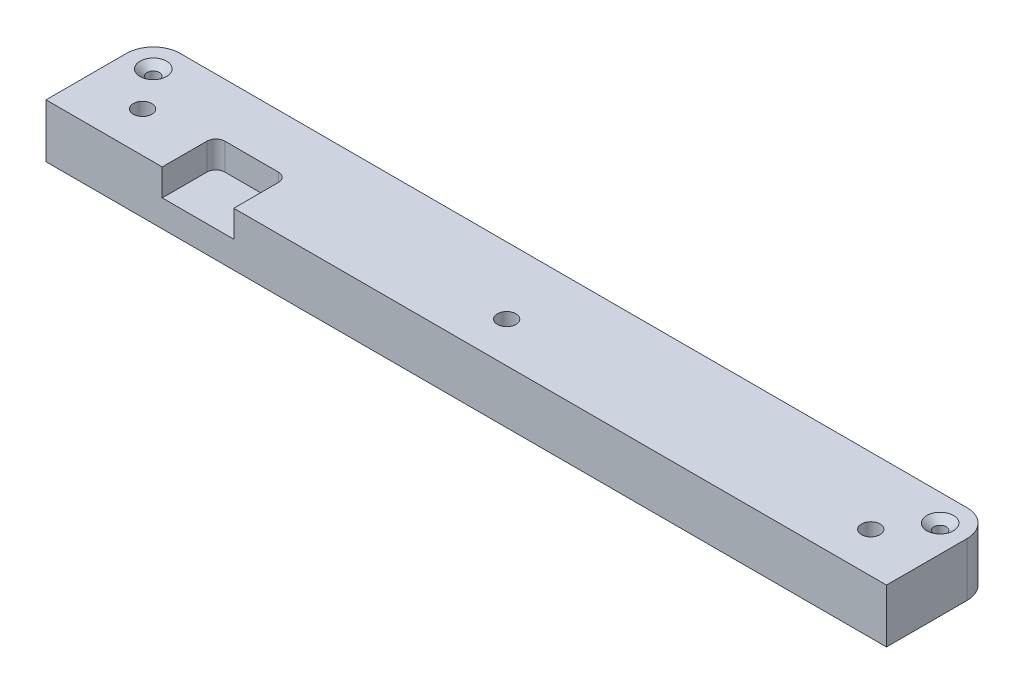
from build123d import *

# Parameters (mm, degrees)
SKETCH1_W           = 298.45
SKETCH1_H           = 38.1
BOSS_EXTRUDE1_DEPTH = 19.05
FILLET1_R           = 9.525
SKETCH2_R           = 3.302
CUT_EXTRUDE1_DEPTH  = 14.2875
SKETCH4_R           = 1.6256
CUT_EXTRUDE2_DEPTH  = 302.47456775
SKETCH5_R           = 2.667
CUT_EXTRUDE3_DEPTH  = 2.921
SKETCH6_R           = 2.1844
CUT_EXTRUDE4_DEPTH  = 302.47456775
CHAMFER1_SIZE       = 2.54
CHAMFER1_SIZE2      = 2.207988314
CUT_EXTRUDE5_START  = -5.08
SKETCH7_R           = 7.239
CUT_EXTRUDE5_DEPTH  = 297.39456775
CUT_EXTRUDE6_START  = -9.525
SKETCH8_W           = 25.4
SKETCH8_H           = 19.05
CUT_EXTRUDE6_DEPTH  = 9.525
FILLET2_R           = 3.175


with BuildPart() as part:
    # Sketch1 → Boss-Extrude1 (new body)
    with BuildSketch(Plane(origin=(0, 0, 0), x_dir=(1, 0, 0), z_dir=(0, 1, 0))):
        with Locations((149.225, 19.05)):
            Rectangle(SKETCH1_W, SKETCH1_H)
    extrude(amount=BOSS_EXTRUDE1_DEPTH)

    # Fillet1
    fillet1_edges = [part.edges().sort_by_distance(p)[0] for p in [
        (298.45, 9.525, -38.1),
        (0, 9.525, -38.1),
    ]]
    fillet(fillet1_edges, radius=FILLET1_R)

    # Sketch2 → Cut-Extrude1 (cut)
    with BuildSketch(Plane(origin=(0, 19.05, 0), x_dir=(1, 0, 0), z_dir=(0, 1, 0))):
        with Locations((19.939, 14.351)):
            Circle(SKETCH2_R)
        with Locations((149.225, 14.351)):
            Circle(SKETCH2_R)
        with Locations((278.511, 14.351)):
            Circle(SKETCH2_R)
    extrude(amount=-CUT_EXTRUDE1_DEPTH, mode=Mode.SUBTRACT)

    # Sketch4 → Cut-Extrude2 (cut, through all)
    with BuildSketch(Plane.XZ):
        with Locations((19.939, -14.351)):
            Circle(SKETCH4_R)
        with Locations((149.225, -14.351)):
            Circle(SKETCH4_R)
        with Locations((278.511, -14.351)):
            Circle(SKETCH4_R)
    extrude(amount=-CUT_EXTRUDE2_DEPTH, mode=Mode.SUBTRACT)

    # Sketch5 → Cut-Extrude3 (cut)
    with BuildSketch(Plane.XZ):
        with Locations((19.939, -14.351)):
            Circle(SKETCH5_R)
        with Locations((149.225, -14.351)):
            Circle(SKETCH5_R)
        with Locations((278.511, -14.351)):
            Circle(SKETCH5_R)
    extrude(amount=-CUT_EXTRUDE3_DEPTH, mode=Mode.SUBTRACT)

    # Sketch6 → Cut-Extrude4 (cut, through all)
    with BuildSketch(Plane(origin=(0, 19.05, 0), x_dir=(1, 0, 0), z_dir=(0, 1, 0))):
        with Locations((288.925, 28.575)):
            Circle(SKETCH6_R)
        with Locations((9.525, 28.575)):
            Circle(SKETCH6_R)
    extrude(amount=-CUT_EXTRUDE4_DEPTH, mode=Mode.SUBTRACT)

    # Chamfer1
    chamfer1_edges = [part.edges().sort_by_distance(p)[0] for p in [
        (286.7406, 19.05, -28.575),
        (7.3406, 19.05, -28.575),
    ]]
    chamfer1_side = [part.faces().sort_by_distance(p)[0] for p in [
        (149.225, 19.05, -19.008778326),
    ]]
    chamfer(chamfer1_edges, length=CHAMFER1_SIZE, length2=CHAMFER1_SIZE2, reference=chamfer1_side[0])

    # Sketch7 → Cut-Extrude5 (cut, through all)
    with BuildSketch(Plane(origin=(0, 19.05, 0), x_dir=(1, 0, 0), z_dir=(0, 1, 0)).offset(CUT_EXTRUDE5_START)):
        with Locations((149.225, 28.575)):
            Circle(SKETCH7_R)
    extrude(amount=-CUT_EXTRUDE5_DEPTH, mode=Mode.SUBTRACT)

    # Sketch8 → Cut-Extrude6 (cut)
    with BuildSketch(Plane.XZ.offset(CUT_EXTRUDE6_START)):
        with Locations((53.975, -9.525)):
            Rectangle(SKETCH8_W, SKETCH8_H)
    extrude(amount=-CUT_EXTRUDE6_DEPTH, mode=Mode.SUBTRACT)

    # Fillet2
    fillet2_edges = [part.edges().sort_by_distance(p)[0] for p in [
        (66.675, 14.2875, -19.05),
        (41.275, 14.2875, -19.05),
    ]]
    fillet(fillet2_edges, radius=FILLET2_R)


solid = part.part
